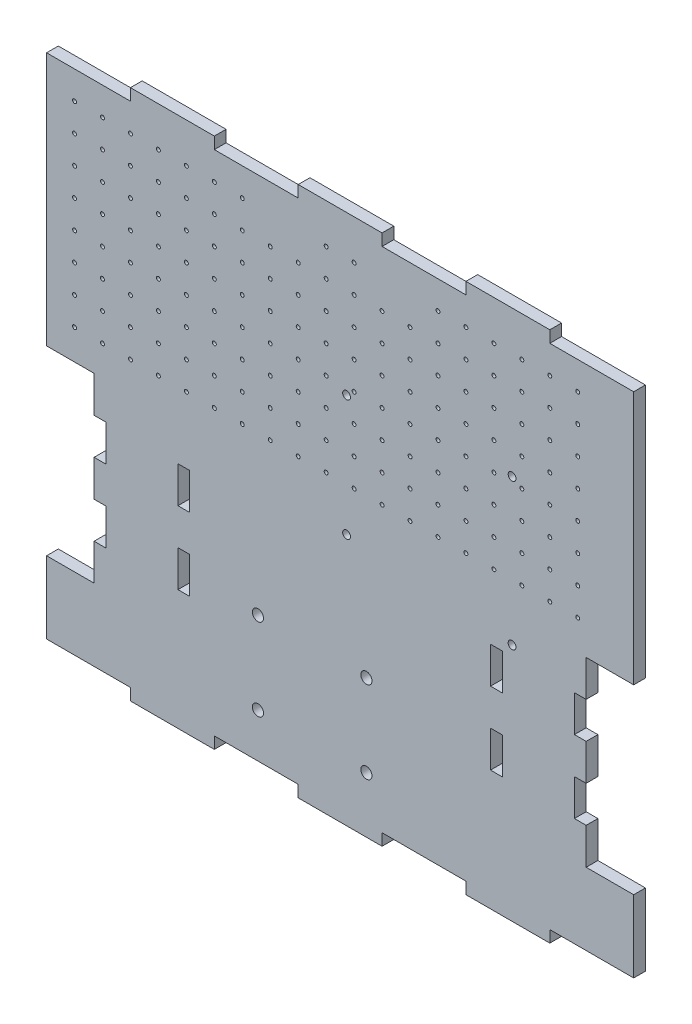
from build123d import *

# Parameters (mm, degrees)
SKETCH1_W           = 266.7
SKETCH1_H           = 241.3
BOSS_EXTRUDE1_DEPTH = 5.334
SKETCH2_W           = 21.59
SKETCH2_H           = 82.55
CUT_EXTRUDE1_DEPTH  = 180.908578328
SKETCH9_W           = 5.334
SKETCH9_H           = 16.51
CUT_EXTRUDE2_DEPTH  = 180.908578328
SKETCH10_R          = 2.54
CUT_EXTRUDE3_DEPTH  = 180.908578328
SKETCH23_W          = 5.334
SKETCH23_H          = 16.51
CUT_EXTRUDE8_DEPTH  = 180.908578328
SKETCH28_W          = 38.1
SKETCH28_H          = 5.334
CUT_EXTRUDE13_DEPTH = 180.908578328
SKETCH29_W          = 38.1
SKETCH29_H          = 5.334
CUT_EXTRUDE14_DEPTH = 180.908578328
SKETCH30_R          = 0.889
CUT_EXTRUDE15_DEPTH = 180.908578328
SKETCH32_R          = 1.778
CUT_EXTRUDE16_DEPTH = 180.908578328


with BuildPart() as part:
    # Sketch1 → Boss-Extrude1 (new body)
    with BuildSketch(Plane.XY):
        Rectangle(SKETCH1_W, SKETCH1_H)
    extrude(amount=BOSS_EXTRUDE1_DEPTH)

    # Sketch2 → Cut-Extrude1 (cut, through all)
    with BuildSketch(Plane(origin=(0, 0, 0), x_dir=(-1, 0, 0), z_dir=(0, 0, -1))):
        with Locations((122.555, -41.275)):
            Rectangle(SKETCH2_W, SKETCH2_H)
        with Locations((-122.555, -41.275)):
            Rectangle(SKETCH2_W, SKETCH2_H)
    extrude(amount=-CUT_EXTRUDE1_DEPTH, mode=Mode.SUBTRACT)

    # Sketch9 → Cut-Extrude2 (cut, through all)
    with BuildSketch(Plane.XY.offset(5.334)):
        with Locations((-109.093, -24.765)):
            Rectangle(SKETCH9_W, SKETCH9_H)
        with Locations((-109.093, -57.785)):
            Rectangle(SKETCH9_W, SKETCH9_H)
        with Locations((109.093, -57.785)):
            Rectangle(SKETCH9_W, SKETCH9_H)
        with Locations((109.093, -24.765)):
            Rectangle(SKETCH9_W, SKETCH9_H)
    extrude(amount=-CUT_EXTRUDE2_DEPTH, mode=Mode.SUBTRACT)

    # Sketch10 → Cut-Extrude3 (cut, through all)
    with BuildSketch(Plane.XY.offset(5.334)):
        with Locations((-37.338, -95.25)):
            Circle(SKETCH10_R)
        with Locations((11.938, -95.25)):
            Circle(SKETCH10_R)
        with Locations((11.938, -57.912)):
            Circle(SKETCH10_R)
        with Locations((-37.338, -57.912)):
            Circle(SKETCH10_R)
    extrude(amount=-CUT_EXTRUDE3_DEPTH, mode=Mode.SUBTRACT)

    # Sketch23 → Cut-Extrude8 (cut, through all)
    with BuildSketch(Plane.XY.offset(5.334)):
        with Locations((-70.993, -57.785)):
            Rectangle(SKETCH23_W, SKETCH23_H)
        with Locations((70.993, -24.765)):
            Rectangle(SKETCH23_W, SKETCH23_H)
        with Locations((70.993, -57.785)):
            Rectangle(SKETCH23_W, SKETCH23_H)
        with Locations((-70.993, -24.765)):
            Rectangle(SKETCH23_W, SKETCH23_H)
    extrude(amount=-CUT_EXTRUDE8_DEPTH, mode=Mode.SUBTRACT)

    # Sketch28 → Cut-Extrude13 (cut, through all)
    with BuildSketch(Plane(origin=(0, 0, 0), x_dir=(-1, 0, 0), z_dir=(0, 0, -1))):
        with Locations((-114.3, -117.983)):
            Rectangle(SKETCH28_W, SKETCH28_H)
        with Locations((-38.1, -117.983)):
            Rectangle(SKETCH28_W, SKETCH28_H)
        with Locations((38.1, -117.983)):
            Rectangle(SKETCH28_W, SKETCH28_H)
        with Locations((114.3, -117.983)):
            Rectangle(SKETCH28_W, SKETCH28_H)
    extrude(amount=-CUT_EXTRUDE13_DEPTH, mode=Mode.SUBTRACT)

    # Sketch29 → Cut-Extrude14 (cut, through all)
    with BuildSketch(Plane(origin=(0, 0, 0), x_dir=(-1, 0, 0), z_dir=(0, 0, -1))):
        with Locations((-114.3, 117.983)):
            Rectangle(SKETCH29_W, SKETCH29_H)
        with Locations((-38.1, 117.983)):
            Rectangle(SKETCH29_W, SKETCH29_H)
        with Locations((38.1, 117.983)):
            Rectangle(SKETCH29_W, SKETCH29_H)
        with Locations((114.3, 117.983)):
            Rectangle(SKETCH29_W, SKETCH29_H)
    extrude(amount=-CUT_EXTRUDE14_DEPTH, mode=Mode.SUBTRACT)

    # Sketch30 → Cut-Extrude15 (cut, through all)
    with BuildSketch(Plane.XY.offset(5.334)):
        with Locations((-120.65, 102.616)):
            Circle(SKETCH30_R)
        with Locations((-107.95, 102.616)):
            Circle(SKETCH30_R)
        with Locations((-95.25, 102.616)):
            Circle(SKETCH30_R)
        with Locations((-82.55, 102.616)):
            Circle(SKETCH30_R)
        with Locations((-69.85, 102.616)):
            Circle(SKETCH30_R)
        with Locations((-57.15, 102.616)):
            Circle(SKETCH30_R)
        with Locations((-44.45, 102.616)):
            Circle(SKETCH30_R)
        with Locations((-6.35, 102.616)):
            Circle(SKETCH30_R)
        with Locations((6.35, 102.616)):
            Circle(SKETCH30_R)
        with Locations((44.45, 102.616)):
            Circle(SKETCH30_R)
        with Locations((57.15, 102.616)):
            Circle(SKETCH30_R)
        with Locations((69.85, 102.616)):
            Circle(SKETCH30_R)
        with Locations((82.55, 102.616)):
            Circle(SKETCH30_R)
        with Locations((95.25, 102.616)):
            Circle(SKETCH30_R)
        with Locations((107.95, 102.616)):
            Circle(SKETCH30_R)
        with Locations((-107.95, 89.916)):
            Circle(SKETCH30_R)
        with Locations((-95.25, 89.916)):
            Circle(SKETCH30_R)
        with Locations((-82.55, 89.916)):
            Circle(SKETCH30_R)
        with Locations((-69.85, 89.916)):
            Circle(SKETCH30_R)
        with Locations((-57.15, 89.916)):
            Circle(SKETCH30_R)
        with Locations((-44.45, 89.916)):
            Circle(SKETCH30_R)
        with Locations((-31.75, 89.916)):
            Circle(SKETCH30_R)
        with Locations((-19.05, 89.916)):
            Circle(SKETCH30_R)
        with Locations((-6.35, 89.916)):
            Circle(SKETCH30_R)
        with Locations((6.35, 89.916)):
            Circle(SKETCH30_R)
        with Locations((19.05, 89.916)):
            Circle(SKETCH30_R)
        with Locations((31.75, 89.916)):
            Circle(SKETCH30_R)
        with Locations((44.45, 89.916)):
            Circle(SKETCH30_R)
        with Locations((57.15, 89.916)):
            Circle(SKETCH30_R)
        with Locations((69.85, 89.916)):
            Circle(SKETCH30_R)
        with Locations((82.55, 89.916)):
            Circle(SKETCH30_R)
        with Locations((95.25, 89.916)):
            Circle(SKETCH30_R)
        with Locations((107.95, 89.916)):
            Circle(SKETCH30_R)
        with Locations((-107.95, 77.216)):
            Circle(SKETCH30_R)
        with Locations((-95.25, 77.216)):
            Circle(SKETCH30_R)
        with Locations((-82.55, 77.216)):
            Circle(SKETCH30_R)
        with Locations((-69.85, 77.216)):
            Circle(SKETCH30_R)
        with Locations((-57.15, 77.216)):
            Circle(SKETCH30_R)
        with Locations((-44.45, 77.216)):
            Circle(SKETCH30_R)
        with Locations((-31.75, 77.216)):
            Circle(SKETCH30_R)
        with Locations((-19.05, 77.216)):
            Circle(SKETCH30_R)
        with Locations((-6.35, 77.216)):
            Circle(SKETCH30_R)
        with Locations((6.35, 77.216)):
            Circle(SKETCH30_R)
        with Locations((19.05, 77.216)):
            Circle(SKETCH30_R)
        with Locations((31.75, 77.216)):
            Circle(SKETCH30_R)
        with Locations((44.45, 77.216)):
            Circle(SKETCH30_R)
        with Locations((57.15, 77.216)):
            Circle(SKETCH30_R)
        with Locations((69.85, 77.216)):
            Circle(SKETCH30_R)
        with Locations((82.55, 77.216)):
            Circle(SKETCH30_R)
        with Locations((95.25, 77.216)):
            Circle(SKETCH30_R)
        with Locations((107.95, 77.216)):
            Circle(SKETCH30_R)
        with Locations((-107.95, 64.516)):
            Circle(SKETCH30_R)
        with Locations((-95.25, 64.516)):
            Circle(SKETCH30_R)
        with Locations((-82.55, 64.516)):
            Circle(SKETCH30_R)
        with Locations((-69.85, 64.516)):
            Circle(SKETCH30_R)
        with Locations((-57.15, 64.516)):
            Circle(SKETCH30_R)
        with Locations((-44.45, 64.516)):
            Circle(SKETCH30_R)
        with Locations((-31.75, 64.516)):
            Circle(SKETCH30_R)
        with Locations((-19.05, 64.516)):
            Circle(SKETCH30_R)
        with Locations((-6.35, 64.516)):
            Circle(SKETCH30_R)
        with Locations((6.35, 64.516)):
            Circle(SKETCH30_R)
        with Locations((19.05, 64.516)):
            Circle(SKETCH30_R)
        with Locations((31.75, 64.516)):
            Circle(SKETCH30_R)
        with Locations((44.45, 64.516)):
            Circle(SKETCH30_R)
        with Locations((57.15, 64.516)):
            Circle(SKETCH30_R)
        with Locations((69.85, 64.516)):
            Circle(SKETCH30_R)
        with Locations((82.55, 64.516)):
            Circle(SKETCH30_R)
        with Locations((95.25, 64.516)):
            Circle(SKETCH30_R)
        with Locations((107.95, 64.516)):
            Circle(SKETCH30_R)
        with Locations((-107.95, 51.816)):
            Circle(SKETCH30_R)
        with Locations((-95.25, 51.816)):
            Circle(SKETCH30_R)
        with Locations((-82.55, 51.816)):
            Circle(SKETCH30_R)
        with Locations((-69.85, 51.816)):
            Circle(SKETCH30_R)
        with Locations((-57.15, 51.816)):
            Circle(SKETCH30_R)
        with Locations((-44.45, 51.816)):
            Circle(SKETCH30_R)
        with Locations((-31.75, 51.816)):
            Circle(SKETCH30_R)
        with Locations((-19.05, 51.816)):
            Circle(SKETCH30_R)
        with Locations((-6.35, 51.816)):
            Circle(SKETCH30_R)
        with Locations((6.35, 51.816)):
            Circle(SKETCH30_R)
        with Locations((19.05, 51.816)):
            Circle(SKETCH30_R)
        with Locations((31.75, 51.816)):
            Circle(SKETCH30_R)
        with Locations((44.45, 51.816)):
            Circle(SKETCH30_R)
        with Locations((57.15, 51.816)):
            Circle(SKETCH30_R)
        with Locations((69.85, 51.816)):
            Circle(SKETCH30_R)
        with Locations((82.55, 51.816)):
            Circle(SKETCH30_R)
        with Locations((95.25, 51.816)):
            Circle(SKETCH30_R)
        with Locations((107.95, 51.816)):
            Circle(SKETCH30_R)
        with Locations((-107.95, 39.116)):
            Circle(SKETCH30_R)
        with Locations((-95.25, 39.116)):
            Circle(SKETCH30_R)
        with Locations((-82.55, 39.116)):
            Circle(SKETCH30_R)
        with Locations((-69.85, 39.116)):
            Circle(SKETCH30_R)
        with Locations((-57.15, 39.116)):
            Circle(SKETCH30_R)
        with Locations((-44.45, 39.116)):
            Circle(SKETCH30_R)
        with Locations((-31.75, 39.116)):
            Circle(SKETCH30_R)
        with Locations((-19.05, 39.116)):
            Circle(SKETCH30_R)
        with Locations((-6.35, 39.116)):
            Circle(SKETCH30_R)
        with Locations((6.35, 39.116)):
            Circle(SKETCH30_R)
        with Locations((19.05, 39.116)):
            Circle(SKETCH30_R)
        with Locations((31.75, 39.116)):
            Circle(SKETCH30_R)
        with Locations((44.45, 39.116)):
            Circle(SKETCH30_R)
        with Locations((57.15, 39.116)):
            Circle(SKETCH30_R)
        with Locations((69.85, 39.116)):
            Circle(SKETCH30_R)
        with Locations((82.55, 39.116)):
            Circle(SKETCH30_R)
        with Locations((95.25, 39.116)):
            Circle(SKETCH30_R)
        with Locations((107.95, 39.116)):
            Circle(SKETCH30_R)
        with Locations((-107.95, 26.416)):
            Circle(SKETCH30_R)
        with Locations((-95.25, 26.416)):
            Circle(SKETCH30_R)
        with Locations((-82.55, 26.416)):
            Circle(SKETCH30_R)
        with Locations((-69.85, 26.416)):
            Circle(SKETCH30_R)
        with Locations((-57.15, 26.416)):
            Circle(SKETCH30_R)
        with Locations((-44.45, 26.416)):
            Circle(SKETCH30_R)
        with Locations((-31.75, 26.416)):
            Circle(SKETCH30_R)
        with Locations((-19.05, 26.416)):
            Circle(SKETCH30_R)
        with Locations((-6.35, 26.416)):
            Circle(SKETCH30_R)
        with Locations((6.35, 26.416)):
            Circle(SKETCH30_R)
        with Locations((19.05, 26.416)):
            Circle(SKETCH30_R)
        with Locations((31.75, 26.416)):
            Circle(SKETCH30_R)
        with Locations((44.45, 26.416)):
            Circle(SKETCH30_R)
        with Locations((57.15, 26.416)):
            Circle(SKETCH30_R)
        with Locations((69.85, 26.416)):
            Circle(SKETCH30_R)
        with Locations((82.55, 26.416)):
            Circle(SKETCH30_R)
        with Locations((95.25, 26.416)):
            Circle(SKETCH30_R)
        with Locations((107.95, 26.416)):
            Circle(SKETCH30_R)
        with Locations((-107.95, 13.716)):
            Circle(SKETCH30_R)
        with Locations((-95.25, 13.716)):
            Circle(SKETCH30_R)
        with Locations((-82.55, 13.716)):
            Circle(SKETCH30_R)
        with Locations((-69.85, 13.716)):
            Circle(SKETCH30_R)
        with Locations((-57.15, 13.716)):
            Circle(SKETCH30_R)
        with Locations((-44.45, 13.716)):
            Circle(SKETCH30_R)
        with Locations((-31.75, 13.716)):
            Circle(SKETCH30_R)
        with Locations((-19.05, 13.716)):
            Circle(SKETCH30_R)
        with Locations((-6.35, 13.716)):
            Circle(SKETCH30_R)
        with Locations((6.35, 13.716)):
            Circle(SKETCH30_R)
        with Locations((19.05, 13.716)):
            Circle(SKETCH30_R)
        with Locations((31.75, 13.716)):
            Circle(SKETCH30_R)
        with Locations((44.45, 13.716)):
            Circle(SKETCH30_R)
        with Locations((57.15, 13.716)):
            Circle(SKETCH30_R)
        with Locations((69.85, 13.716)):
            Circle(SKETCH30_R)
        with Locations((82.55, 13.716)):
            Circle(SKETCH30_R)
        with Locations((95.25, 13.716)):
            Circle(SKETCH30_R)
        with Locations((107.95, 13.716)):
            Circle(SKETCH30_R)
        with Locations((-120.65, 89.916)):
            Circle(SKETCH30_R)
        with Locations((-120.65, 77.216)):
            Circle(SKETCH30_R)
        with Locations((-120.65, 64.516)):
            Circle(SKETCH30_R)
        with Locations((-120.65, 51.816)):
            Circle(SKETCH30_R)
        with Locations((-120.65, 39.116)):
            Circle(SKETCH30_R)
        with Locations((-120.65, 26.416)):
            Circle(SKETCH30_R)
        with Locations((-120.65, 13.716)):
            Circle(SKETCH30_R)
    extrude(amount=-CUT_EXTRUDE15_DEPTH, mode=Mode.SUBTRACT)

    # Sketch32 → Cut-Extrude16 (cut, through all)
    with BuildSketch(Plane(origin=(0, 0, 0), x_dir=(-1, 0, 0), z_dir=(0, 0, -1))):
        with Locations((-78.105, -11.938)):
            Circle(SKETCH32_R)
        with Locations((-2.921, -6.096)):
            Circle(SKETCH32_R)
        with Locations((-78.105, 54.356)):
            Circle(SKETCH32_R)
        with Locations((-2.921, 48.768)):
            Circle(SKETCH32_R)
    extrude(amount=-CUT_EXTRUDE16_DEPTH, mode=Mode.SUBTRACT)


solid = part.part
